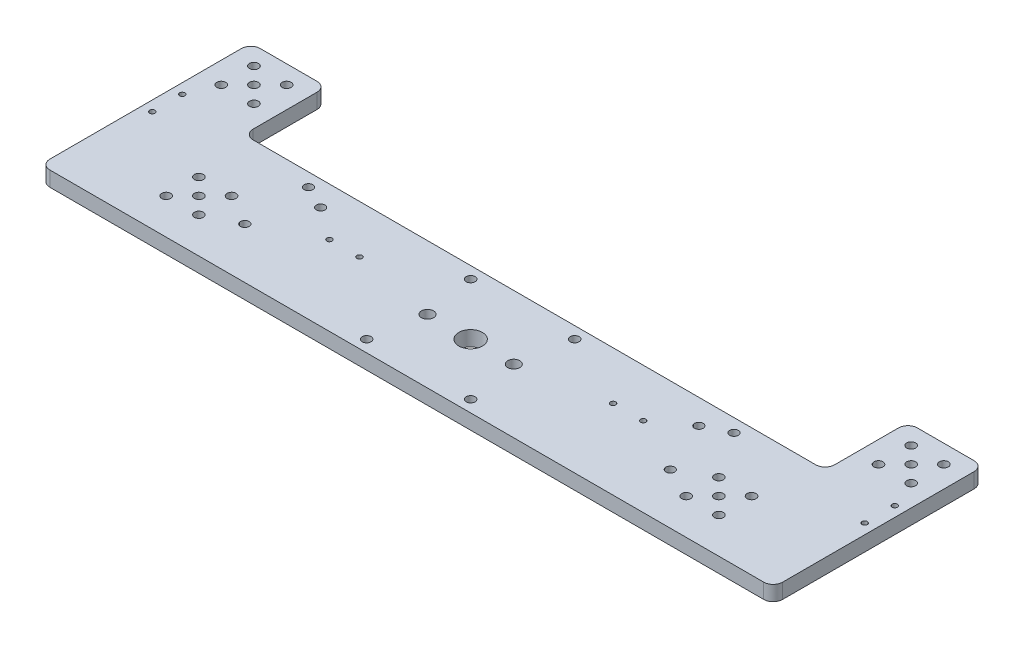
from build123d import *

# Parameters (mm, degrees)
BOSS_EXTRUDE1_DEPTH                = 6.35
SKETCH2_R                          = 5
CUT_EXTRUDE1_DEPTH                 = 168.060834728
F_6_CLEARANCE_HOLE1_D              = 3.7973
F_6_CLEARANCE_HOLE1_DEPTH          = 10
F_6_CLEARANCE_HOLE1_TIP            = 1.140824014
FILLET1_R                          = 4
F_10_CLEARANCE_HOLE1_D             = 5.1054
F_10_CLEARANCE_HOLE1_DEPTH         = 10
F_10_CLEARANCE_HOLE1_TIP           = 1.533816902
F_6_CLEARANCE_HOLE2_D              = 3.6576
TAP_DRILL_FOR_4_40_TAP1_AT_2_COUNT = 2
TAP_DRILL_FOR_4_40_TAP1_AT_2_PITCH = 12.7
TAP_DRILL_FOR_4_40_TAP1_AT_3_COUNT = 2
TAP_DRILL_FOR_4_40_TAP1_AT_3_PITCH = 87.197900347
TAP_DRILL_FOR_4_40_TAP1_AT_4_COUNT = 2
TAP_DRILL_FOR_4_40_TAP1_AT_4_PITCH = 99.536464801


with BuildPart() as part:
    # Sketch1 → Boss-Extrude1 (new body)
    with BuildSketch(Plane(origin=(0, 0, 0), x_dir=(1, 0, 0), z_dir=(0, 1, 0))):
        Polygon((-155, -27), (155, -27), (155, 27), (155, 62), (123, 62), (123, 27), (-123, 27), (-123, 62), (-155, 62), (-155, 27), align=None)
    extrude(amount=BOSS_EXTRUDE1_DEPTH)

    # Sketch2 → Cut-Extrude1 (cut, through all)
    with BuildSketch(Plane(origin=(0, 6.35, 0), x_dir=(1, 0, 0), z_dir=(0, 1, 0))):
        Circle(SKETCH2_R)
    extrude(amount=-CUT_EXTRUDE1_DEPTH, mode=Mode.SUBTRACT)

    # #6 Clearance Hole1
    with Locations(Plane(origin=(-145.941, 6.35, -54.265), x_dir=(0, 0, 1), z_dir=(0, 1, 0))):
        with Locations((0, 0), (0, 13.83), (13.83, 13.83), (13.83, 0), (6.915, 6.915), (52.324, 29.026), (52.324, 42.856), (66.154, 42.856), (66.154, 29.026), (59.239, 35.941), (32.265, 123.941), (32.265, 167.941), (76.265, 167.941), (76.265, 123.941), (66.154, 249.026), (52.324, 249.026), (52.324, 262.856), (66.154, 262.856), (59.239, 255.941), (13.83, 278.052), (6.915, 284.967), (0, 278.052), (0, 291.882), (13.83, 291.882)):
            Hole(F_6_CLEARANCE_HOLE1_D / 2, depth=F_6_CLEARANCE_HOLE1_DEPTH)
            with Locations((0, 0, -(F_6_CLEARANCE_HOLE1_DEPTH + F_6_CLEARANCE_HOLE1_TIP / 2))):  # 118° drill point
                Cone(0, F_6_CLEARANCE_HOLE1_D / 2, F_6_CLEARANCE_HOLE1_TIP, mode=Mode.SUBTRACT)

    # Fillet1
    fillet1_edges = [part.edges().sort_by_distance(p)[0] for p in [
        (155, 3.175, 27),
        (155, 3.175, -62),
        (123, 3.175, -62),
        (123, 3.175, -27),
        (-123, 3.175, -27),
        (-155, 3.175, 27),
        (-123, 3.175, -62),
        (-155, 3.175, -62),
    ]]
    fillet(fillet1_edges, radius=FILLET1_R)

    # #10 Clearance Hole1
    with Locations(Plane(origin=(-18.25, 6.35, 0), x_dir=(0, 0, 1), z_dir=(0, 1, 0))):
        with Locations((0, 0), (0, 36.5)):
            Hole(F_10_CLEARANCE_HOLE1_D / 2, depth=F_10_CLEARANCE_HOLE1_DEPTH)
            with Locations((0, 0, -(F_10_CLEARANCE_HOLE1_DEPTH + F_10_CLEARANCE_HOLE1_TIP / 2))):  # 118° drill point
                Cone(0, F_10_CLEARANCE_HOLE1_D / 2, F_10_CLEARANCE_HOLE1_TIP, mode=Mode.SUBTRACT)

    # #6 Clearance Hole2 (through all)
    with Locations(Plane(origin=(0, 6.35, 0), x_dir=(-1, 0, 0), z_dir=(0, 1, 0))):
        with Locations((90, -21.412), (90, 5.5374), (-90, 5.5374), (-90, -21.412), (80, -16.5352), (-80, -16.5352)):
            Hole(F_6_CLEARANCE_HOLE2_D / 2)

    # Sketch11 → Tap Drill for #4-40 Tap1 (revolve, cut)
    with BuildSketch(Plane(origin=(-150.71, 6.35, -28.7), x_dir=(0, 0, 1), z_dir=(1, 0, 0))):
        Polygon((0, 0), (0, 7.029152758), (1.1303, 6.35), (1.1303, 0), align=None)
    tap_drill_for_4_40_tap1 = revolve(axis=Axis((-150.71, 12.7, -28.7), (0, -1, 0)), mode=Mode.SUBTRACT)

    # Tap Drill for #4-40 Tap1 at 2: Tap Drill for #4-40 Tap1 ×2
    with Locations(*[(0, 0, i * TAP_DRILL_FOR_4_40_TAP1_AT_2_PITCH) for i in range(1, TAP_DRILL_FOR_4_40_TAP1_AT_2_COUNT)]):
        add(tap_drill_for_4_40_tap1, mode=Mode.SUBTRACT)

    # Tap Drill for #4-40 Tap1 at 3: Tap Drill for #4-40 Tap1 ×2
    with Locations(*[Vector(0.9674544875952189, 0, 0.2530450837931307) * (i * TAP_DRILL_FOR_4_40_TAP1_AT_3_PITCH) for i in range(1, TAP_DRILL_FOR_4_40_TAP1_AT_3_COUNT)]):
        add(tap_drill_for_4_40_tap1, mode=Mode.SUBTRACT)

    # Tap Drill for #4-40 Tap1 at 4: Tap Drill for #4-40 Tap1 ×2
    with Locations(*[Vector(0.9751200245502414, 0, 0.22167755348960516) * (i * TAP_DRILL_FOR_4_40_TAP1_AT_4_PITCH) for i in range(1, TAP_DRILL_FOR_4_40_TAP1_AT_4_COUNT)]):
        add(tap_drill_for_4_40_tap1, mode=Mode.SUBTRACT)

    # Mirror1: Tap Drill for #4-40 Tap1 across plane
    add(tap_drill_for_4_40_tap1.mirror(Plane(origin=(0, 0, 0), x_dir=(0, 0, 1), z_dir=(1, 0, 0))), mode=Mode.SUBTRACT)

    # Mirror1 copy 1 sketch → Mirror1 copy 1 (revolve, cut)
    with BuildSketch(Plane(origin=(150.71, 6.35, -16), x_dir=(0, 0, 1), z_dir=(-1, 0, 0))):
        Polygon((0, 0), (0, -7.029152758), (1.1303, -6.35), (1.1303, 0), align=None)
    revolve(axis=Axis((150.71, 12.7, -16), (0, 1, 0)), mode=Mode.SUBTRACT)

    # Mirror1 copy 2 sketch → Mirror1 copy 2 (revolve, cut)
    with BuildSketch(Plane(origin=(66.35, 6.35, -6.635), x_dir=(0, 0, 1), z_dir=(-1, 0, 0))):
        Polygon((0, 0), (0, -7.029152758), (1.1303, -6.35), (1.1303, 0), align=None)
    revolve(axis=Axis((66.35, 12.7, -6.635), (0, 1, 0)), mode=Mode.SUBTRACT)

    # Mirror1 copy 3 sketch → Mirror1 copy 3 (revolve, cut)
    with BuildSketch(Plane(origin=(53.65, 6.35, -6.635), x_dir=(0, 0, 1), z_dir=(-1, 0, 0))):
        Polygon((0, 0), (0, -7.029152758), (1.1303, -6.35), (1.1303, 0), align=None)
    revolve(axis=Axis((53.65, 12.7, -6.635), (0, 1, 0)), mode=Mode.SUBTRACT)


solid = part.part
